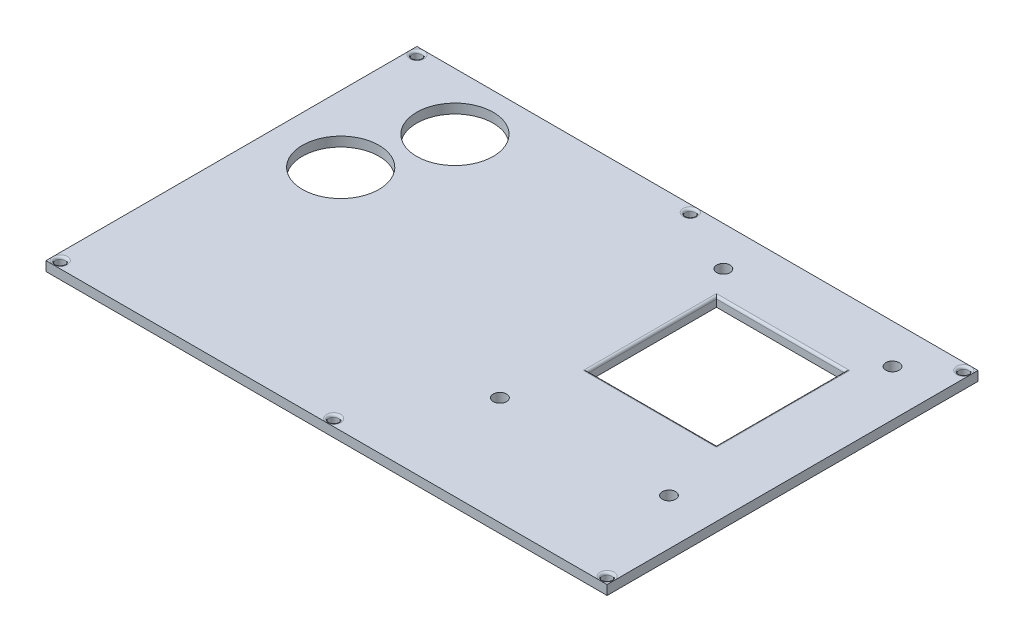
from build123d import *

# Parameters (mm, degrees)
SKETCH1_W           = 118
SKETCH1_H           = 78
BOSS_EXTRUDE1_DEPTH = 2
SKETCH2_R           = 8.05
BUTTONS_DEPTH       = 2
SKETCH3_R           = 1.4
SKETCH3_W           = 27
SKETCH3_H           = 27
OLED_DEPTH          = 2
SKETCH4_R           = 1
SCREW_HOLES_DEPTH   = 2
FILLETS_R           = 0.5


with BuildPart() as part:
    # Sketch1 → Boss-Extrude1 (new body)
    with BuildSketch(Plane(origin=(0, 0, 0), x_dir=(1, 0, 0), z_dir=(0, 1, 0))):
        Rectangle(SKETCH1_W, SKETCH1_H)
    extrude(amount=BOSS_EXTRUDE1_DEPTH)

    # Sketch2 → Buttons (cut)
    with BuildSketch(Plane(origin=(0, 2, 0), x_dir=(1, 0, 0), z_dir=(0, 1, 0))):
        with Locations(Location((-39, 27, 0), (0, 0, 270))):
            Circle(SKETCH2_R)
        with Locations(Location((-45, 8.972243623, 0), (0, 0, 270))):
            Circle(SKETCH2_R)
    extrude(amount=-BUTTONS_DEPTH, mode=Mode.SUBTRACT)

    # Sketch3 → OLED (cut)
    with BuildSketch(Plane(origin=(0, 2, 0), x_dir=(1, 0, 0), z_dir=(0, 1, 0))):
        with Locations(Location((13.72, 30.73134663, 0), (0, 0, 270))):
            Circle(SKETCH3_R)
        with Locations(Location((49.28, 30.73134663, 0), (0, 0, 270))):
            Circle(SKETCH3_R)
        with Locations(Location((13.72, -16.25865337, 0), (0, 0, 270))):
            Circle(SKETCH3_R)
        with Locations(Location((49.28, -16.25865337, 0), (0, 0, 270))):
            Circle(SKETCH3_R)
        with Locations((31.5, 11.5)):
            Rectangle(SKETCH3_W, SKETCH3_H)
    extrude(amount=-OLED_DEPTH, mode=Mode.SUBTRACT)

    # Sketch4 → Screw Holes (cut)
    with BuildSketch(Plane(origin=(0, 2, 0), x_dir=(1, 0, 0), z_dir=(0, 1, 0))):
        with Locations(Location((-57.5, 37.5, 0), (0, 0, 270))):
            Circle(SKETCH4_R)
        with Locations(Location((-57.5, -37.5, 0), (0, 0, 270))):
            Circle(SKETCH4_R)
        with Locations(Location((57.5, -37.5, 0), (0, 0, 270))):
            Circle(SKETCH4_R)
        with Locations(Location((57.5, 37.5, 0), (0, 0, 270))):
            Circle(SKETCH4_R)
        with Locations(Location((0, 37.5, 0), (0, 0, 270))):
            Circle(SKETCH4_R)
        with Locations(Location((0, -37.5, 0), (0, 0, 270))):
            Circle(SKETCH4_R)
    extrude(amount=-SCREW_HOLES_DEPTH, mode=Mode.SUBTRACT)

    # Fillets
    fillets_edges = [part.edges().sort_by_distance(p)[0] for p in [
        (18, 2, -11.5),
        (31.5, 2, 2),
        (45, 2, -11.5),
        (31.5, 2, -25),
        (-57.5, 2, 36.5),
        (57.5, 2, 36.5),
        (57.5, 2, -38.5),
        (0, 2, -38.5),
        (0, 2, 36.5),
        (-57.5, 2, -38.5),
    ]]
    fillet(fillets_edges, radius=FILLETS_R - 0.0001)  # a hair under: the kernel refuses the full size


solid = part.part
